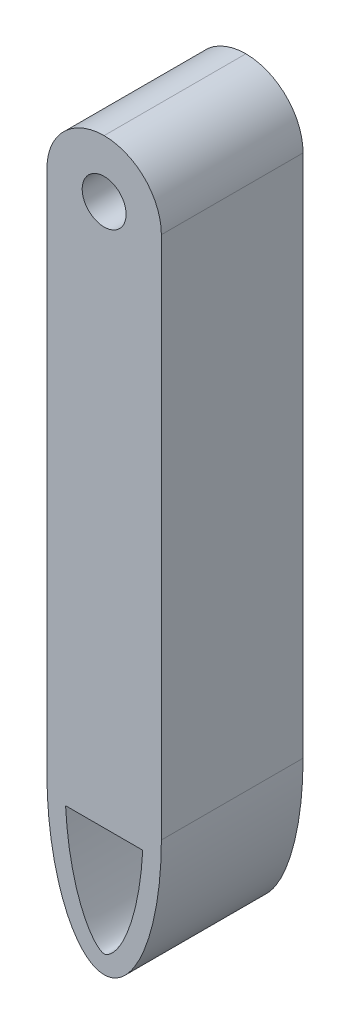
from build123d import *

# Parameters (mm, degrees)
SKETCH1_W               = 40
SKETCH1_H               = 203.2
BOSS_EXTRUDE1_DEPTH     = 49.53
FILLET1_R               = 20
CUT_EXTRUDE2_DEPTH      = 213.940040622
CUT_EXTRUDE2_DEPTH_BACK = 213.940040622
SKETCH2_R               = 7.67
BOSS_EXTRUDE2_DEPTH     = 49.53


with BuildPart() as part:
    # Sketch1 → Boss-Extrude1 (new body)
    with BuildSketch(Plane.XY):
        with Locations((20, 101.6)):
            Rectangle(SKETCH1_W, SKETCH1_H)
    extrude(amount=BOSS_EXTRUDE1_DEPTH)

    # Fillet1
    fillet1_edges = [part.edges().sort_by_distance(p)[0] for p in [
        (40, 203.2, 24.765),
        (0, 203.2, 24.765),
    ]]
    fillet(fillet1_edges, radius=FILLET1_R - 0.0001)  # a hair under: the kernel refuses the full size

    # Sketch2 → Cut-Extrude2 (cut, two sides: drawn at the far end of the back side and taken through both)
    with BuildSketch(Plane.XY.offset(-CUT_EXTRUDE2_DEPTH_BACK)):
        with Locations((20, 183.2)):
            Circle(SKETCH2_R)
    extrude(amount=CUT_EXTRUDE2_DEPTH + CUT_EXTRUDE2_DEPTH_BACK, mode=Mode.SUBTRACT)

    # Sketch3 → Boss-Extrude2 (add, through all)
    with BuildSketch(Plane.XY):
        with BuildLine():
            Line((0, 0), (40, 0))
            add(Edge.make_bspline(
                [(0, 0), (0, -50.8), (20, -50.8), (40, -50.8), (40, 0)],
                knots=[4.71238898, 4.71238898, 4.71238898, 6.283185307, 6.283185307, 7.853981634, 7.853981634, 7.853981634], degree=2, weights=[1, 0.707106781, 1, 0.707106781, 1]))
        make_face()
        with BuildLine():
            Line((6.515085657, -6.35), (33.484914343, -6.35))
            add(Edge.make_bspline(
                [(6.515085657, -6.35), (6.589431217, -7.77333469), (6.790688916, -10.636207435), (7.389274782, -16.194532881), (8.497356425, -22.813552225), (10.33548684, -29.899483462), (12.57495803, -35.843858483), (15.040642629, -40.369496111), (17.445316603, -43.243112205), (18.952290908, -44.206431339), (19.650554806, -44.426708037), (20, -44.461645982), (20.349445194, -44.426708037), (21.047709092, -44.206431339), (22.554683397, -43.243112205), (24.959357371, -40.369496111), (27.42504197, -35.843858483), (29.66451316, -29.899483462), (31.502643575, -22.813552225), (32.610725218, -16.194532881), (33.209311084, -10.636207435), (33.410568783, -7.77333469), (33.484914343, -6.35)],
                knots=[-1.438893899, -1.438893899, -1.438893899, -1.438893899, -1.34896303, -1.259032162, -1.079170424, -0.899308687, -0.719446949, -0.539585212, -0.359723475, -0.179861737, -0.089930869, 0, 0.089930869, 0.179861737, 0.359723475, 0.539585212, 0.719446949, 0.899308687, 1.079170424, 1.259032162, 1.34896303, 1.438893899, 1.438893899, 1.438893899, 1.438893899], degree=3))
        make_face(mode=Mode.SUBTRACT)
    extrude(amount=BOSS_EXTRUDE2_DEPTH)


solid = part.part
